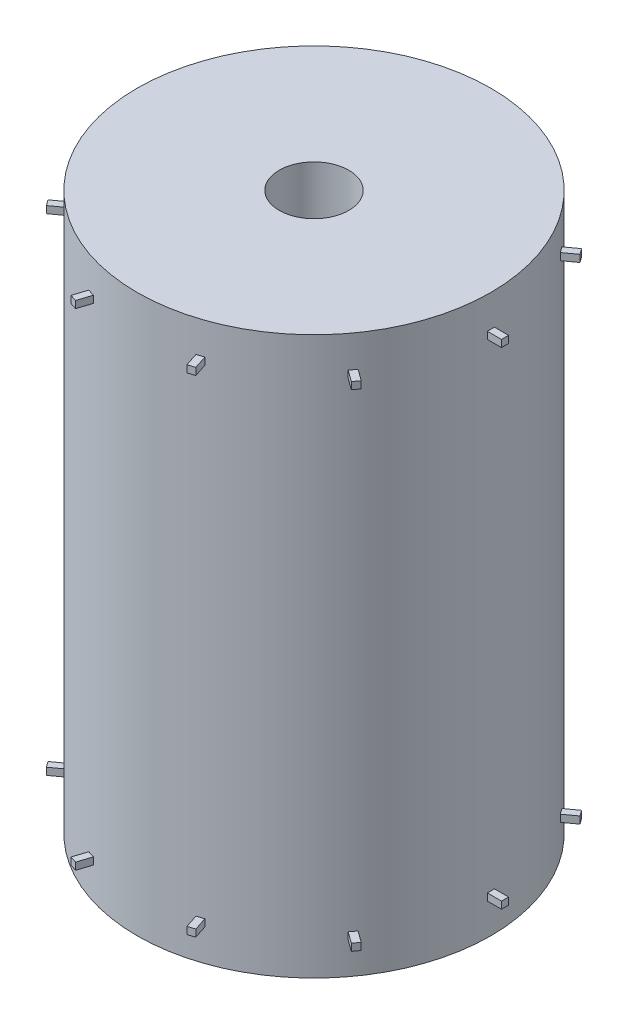
from build123d import *

# Parameters (mm, degrees)
SKETCH1_R                = 12.7
BOSS_EXTRUDE1_DEPTH      = 40
F_5_0MM_DOWEL_HOLE1_D    = 5
BOSS_EXTRUDE2_START      = -2.794
BOSS_EXTRUDE2_DEPTH      = 0.508
CIRPATTERN3_COUNT        = 10
CIRPATTERN3_START        = -2.794
CIRPATTERN3_COPY_1_DEPTH = 0.508
CIRPATTERN3_COPY_2_DEPTH = 0.508
CIRPATTERN3_COPY_3_DEPTH = 0.508
CIRPATTERN3_COPY_4_DEPTH = 0.508
CIRPATTERN3_COPY_5_DEPTH = 0.508
CIRPATTERN3_COPY_6_DEPTH = 0.508
CIRPATTERN3_COPY_7_DEPTH = 0.508
CIRPATTERN3_COPY_8_DEPTH = 0.508
CIRPATTERN3_COPY_9_DEPTH = 0.508


with BuildPart() as part:
    # Sketch1 → Boss-Extrude1 (new body)
    with BuildSketch(Plane(origin=(0, 0, 0), x_dir=(1, 0, 0), z_dir=(0, 1, 0))):
        Circle(SKETCH1_R)
    extrude(amount=BOSS_EXTRUDE1_DEPTH)

    # Ø5.0mm Dowel Hole1 (through all)
    with Locations(Plane(origin=(0, 40, 0), x_dir=(1, 0, 0), z_dir=(0, 1, 0))):
        with Locations((0, 0)):
            Hole(F_5_0MM_DOWEL_HOLE1_D / 2)

    # Sketch4 → Boss-Extrude2 (add)
    with BuildSketch(Plane(origin=(0, 40, 0), x_dir=(1, 0, 0), z_dir=(0, 1, 0)).offset(BOSS_EXTRUDE2_START)):
        with BuildLine():
            Line((13.713459745949187, 0.254), (12.697459745949187, 0.254))
            ThreePointArc((12.697459745949187, 0.25400000000000006), (12.699364920608327, 0.127006351111512), (12.7, 0))
            ThreePointArc((12.7, -3.11e-15), (12.699364920608327, -0.1270063511115117), (12.697459745949187, -0.25400000000000755))
            Line((12.697459745949187, -0.254), (13.713459745949187, -0.254))
            Line((13.713459745949187, -0.254), (13.713459745949187, 0.254))
        make_face()
    boss_extrude2 = extrude(amount=BOSS_EXTRUDE2_DEPTH)

    # Mirror4: Boss-Extrude2 across plane
    add(boss_extrude2.mirror(Plane.ZX.offset(20)))

    # CirPattern3: Boss-Extrude2 ×10 about axis
    cirpattern3_axis = Axis((0, 0, 0), (0, 1, 0))
    for i in range(1, CIRPATTERN3_COUNT):
        add(boss_extrude2.rotate(cirpattern3_axis, i * 360 / CIRPATTERN3_COUNT))

    # CirPattern3 copy 1 sketch → CirPattern3 copy 1 (add)
    with BuildSketch(Plane(origin=(0, 0, 0), x_dir=(0.8090169943749475, 0, -0.5877852522924731), z_dir=(0, -1, 0)).offset(CIRPATTERN3_START)):
        with BuildLine():
            Line((13.713459745949187, -0.254), (12.697459745949187, -0.254))
            ThreePointArc((12.697459745949187, -0.25400000000000006), (12.699364920608327, -0.127006351111512), (12.7, 0))
            ThreePointArc((12.7, 3.11e-15), (12.699364920608327, 0.1270063511115117), (12.697459745949187, 0.25400000000000755))
            Line((12.697459745949187, 0.254), (13.713459745949187, 0.254))
            Line((13.713459745949187, 0.254), (13.713459745949187, -0.254))
        make_face()
    extrude(amount=CIRPATTERN3_COPY_1_DEPTH)

    # CirPattern3 copy 2 sketch → CirPattern3 copy 2 (add)
    with BuildSketch(Plane(origin=(0, 0, 0), x_dir=(0.30901699437494745, 0, -0.9510565162951535), z_dir=(0, -1, 0)).offset(CIRPATTERN3_START)):
        with BuildLine():
            Line((13.713459745949187, -0.254), (12.697459745949187, -0.254))
            ThreePointArc((12.697459745949187, -0.25400000000000006), (12.699364920608327, -0.127006351111512), (12.7, 0))
            ThreePointArc((12.7, 3.11e-15), (12.699364920608327, 0.1270063511115117), (12.697459745949187, 0.25400000000000755))
            Line((12.697459745949187, 0.254), (13.713459745949187, 0.254))
            Line((13.713459745949187, 0.254), (13.713459745949187, -0.254))
        make_face()
    extrude(amount=CIRPATTERN3_COPY_2_DEPTH)

    # CirPattern3 copy 3 sketch → CirPattern3 copy 3 (add)
    with BuildSketch(Plane(origin=(0, 0, 0), x_dir=(-0.30901699437494734, 0, -0.9510565162951536), z_dir=(0, -1, 0)).offset(CIRPATTERN3_START)):
        with BuildLine():
            Line((13.713459745949187, -0.254), (12.697459745949187, -0.254))
            ThreePointArc((12.697459745949187, -0.25400000000000006), (12.699364920608327, -0.127006351111512), (12.7, 0))
            ThreePointArc((12.7, 3.11e-15), (12.699364920608327, 0.1270063511115117), (12.697459745949187, 0.25400000000000755))
            Line((12.697459745949187, 0.254), (13.713459745949187, 0.254))
            Line((13.713459745949187, 0.254), (13.713459745949187, -0.254))
        make_face()
    extrude(amount=CIRPATTERN3_COPY_3_DEPTH)

    # CirPattern3 copy 4 sketch → CirPattern3 copy 4 (add)
    with BuildSketch(Plane(origin=(0, 0, 0), x_dir=(-0.8090169943749473, 0, -0.5877852522924732), z_dir=(0, -1, 0)).offset(CIRPATTERN3_START)):
        with BuildLine():
            Line((13.713459745949187, -0.254), (12.697459745949187, -0.254))
            ThreePointArc((12.697459745949187, -0.25400000000000006), (12.699364920608327, -0.127006351111512), (12.7, 0))
            ThreePointArc((12.7, 3.11e-15), (12.699364920608327, 0.1270063511115117), (12.697459745949187, 0.25400000000000755))
            Line((12.697459745949187, 0.254), (13.713459745949187, 0.254))
            Line((13.713459745949187, 0.254), (13.713459745949187, -0.254))
        make_face()
    extrude(amount=CIRPATTERN3_COPY_4_DEPTH)

    # CirPattern3 copy 5 sketch → CirPattern3 copy 5 (add)
    with BuildSketch(Plane(origin=(0, 0, 0), x_dir=(-1, 0, -1.2e-16), z_dir=(0, -1, 0)).offset(CIRPATTERN3_START)):
        with BuildLine():
            Line((13.713459745949187, -0.254), (12.697459745949187, -0.254))
            ThreePointArc((12.697459745949187, -0.25400000000000006), (12.699364920608327, -0.127006351111512), (12.7, 0))
            ThreePointArc((12.7, 3.11e-15), (12.699364920608327, 0.1270063511115117), (12.697459745949187, 0.25400000000000755))
            Line((12.697459745949187, 0.254), (13.713459745949187, 0.254))
            Line((13.713459745949187, 0.254), (13.713459745949187, -0.254))
        make_face()
    extrude(amount=CIRPATTERN3_COPY_5_DEPTH)

    # CirPattern3 copy 6 sketch → CirPattern3 copy 6 (add)
    with BuildSketch(Plane(origin=(0, 0, 0), x_dir=(-0.8090169943749476, 0, 0.587785252292473), z_dir=(0, -0.9999999999999999, 0)).offset(CIRPATTERN3_START)):
        with BuildLine():
            Line((13.713459745949187, -0.254), (12.697459745949187, -0.254))
            ThreePointArc((12.697459745949187, -0.25400000000000006), (12.699364920608327, -0.127006351111512), (12.7, 0))
            ThreePointArc((12.7, 3.11e-15), (12.699364920608327, 0.1270063511115117), (12.697459745949187, 0.25400000000000755))
            Line((12.697459745949187, 0.254), (13.713459745949187, 0.254))
            Line((13.713459745949187, 0.254), (13.713459745949187, -0.254))
        make_face()
    extrude(amount=CIRPATTERN3_COPY_6_DEPTH)

    # CirPattern3 copy 7 sketch → CirPattern3 copy 7 (add)
    with BuildSketch(Plane(origin=(0, 0, 0), x_dir=(-0.30901699437494756, 0, 0.9510565162951535), z_dir=(0, -0.9999999999999999, 0)).offset(CIRPATTERN3_START)):
        with BuildLine():
            Line((13.713459745949187, -0.254), (12.697459745949187, -0.254))
            ThreePointArc((12.697459745949187, -0.25400000000000006), (12.699364920608327, -0.127006351111512), (12.7, 0))
            ThreePointArc((12.7, 3.11e-15), (12.699364920608327, 0.1270063511115117), (12.697459745949187, 0.25400000000000755))
            Line((12.697459745949187, 0.254), (13.713459745949187, 0.254))
            Line((13.713459745949187, 0.254), (13.713459745949187, -0.254))
        make_face()
    extrude(amount=CIRPATTERN3_COPY_7_DEPTH)

    # CirPattern3 copy 8 sketch → CirPattern3 copy 8 (add)
    with BuildSketch(Plane(origin=(0, 0, 0), x_dir=(0.30901699437494723, 0, 0.9510565162951536), z_dir=(0, -1, 0)).offset(CIRPATTERN3_START)):
        with BuildLine():
            Line((13.713459745949187, -0.254), (12.697459745949187, -0.254))
            ThreePointArc((12.697459745949187, -0.25400000000000006), (12.699364920608327, -0.127006351111512), (12.7, 0))
            ThreePointArc((12.7, 3.11e-15), (12.699364920608327, 0.1270063511115117), (12.697459745949187, 0.25400000000000755))
            Line((12.697459745949187, 0.254), (13.713459745949187, 0.254))
            Line((13.713459745949187, 0.254), (13.713459745949187, -0.254))
        make_face()
    extrude(amount=CIRPATTERN3_COPY_8_DEPTH)

    # CirPattern3 copy 9 sketch → CirPattern3 copy 9 (add)
    with BuildSketch(Plane(origin=(0, 0, 0), x_dir=(0.8090169943749473, 0, 0.5877852522924734), z_dir=(0, -1, 0)).offset(CIRPATTERN3_START)):
        with BuildLine():
            Line((13.713459745949187, -0.254), (12.697459745949187, -0.254))
            ThreePointArc((12.697459745949187, -0.25400000000000006), (12.699364920608327, -0.127006351111512), (12.7, 0))
            ThreePointArc((12.7, 3.11e-15), (12.699364920608327, 0.1270063511115117), (12.697459745949187, 0.25400000000000755))
            Line((12.697459745949187, 0.254), (13.713459745949187, 0.254))
            Line((13.713459745949187, 0.254), (13.713459745949187, -0.254))
        make_face()
    extrude(amount=CIRPATTERN3_COPY_9_DEPTH)


solid = part.part
